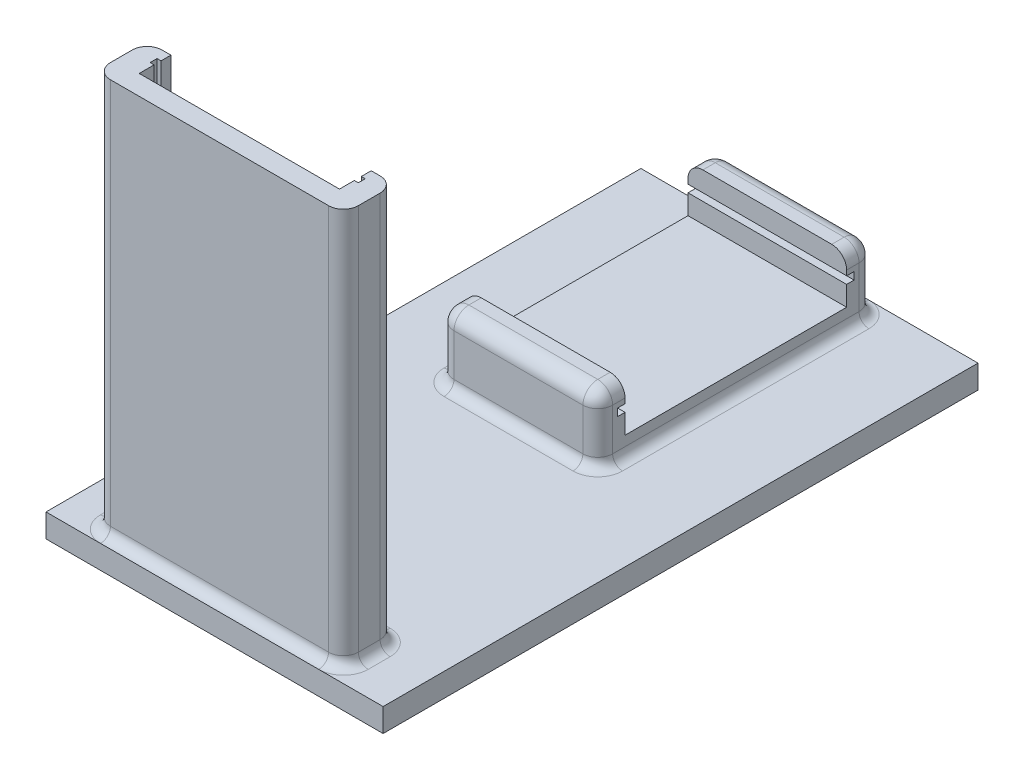
from build123d import *

# Parameters (mm, degrees)
SKETCH2_W               = 88.9
SKETCH2_H               = 152.4
BOSS_EXTRUDE1_DEPTH     = 5.9944
CUT_EXTRUDE2_DEPTH      = 177.535840076
CUT_EXTRUDE2_DEPTH_BACK = 177.535840076
SKETCH4_R               = 2.7305
BOSS_EXTRUDE2_DEPTH     = 101.6
FILLET1_R               = 3.81
FILLET2_R               = 2.54
BOSS_EXTRUDE3_DEPTH     = 20.32
FILLET3_R               = 3.81
FILLET6_R               = 3.81
FILLET7_R               = 2.54
CUT_EXTRUDE3_DEPTH      = 204.596488182
CUT_EXTRUDE3_DEPTH_BACK = 204.596488182
SKETCH7_W               = 2.54
SKETCH7_H               = 152.4


with BuildPart() as part:
    # Sketch2 → Boss-Extrude1 (new body)
    with BuildSketch(Plane(origin=(0, 0, 0), x_dir=(1, 0, 0), z_dir=(0, 1, 0))):
        with Locations((44.45, 76.2)):
            Rectangle(SKETCH2_W, SKETCH2_H)
    extrude(amount=BOSS_EXTRUDE1_DEPTH)

    # Sketch4 → Cut-Extrude2 (cut, two sides: drawn at the far end of the back side and taken through both)
    with BuildSketch(Plane(origin=(0, 5.9944, 0), x_dir=(1, 0, 0), z_dir=(0, 1, 0)).offset(-CUT_EXTRUDE2_DEPTH_BACK)):
        with Locations(Location((45.72, 109.871331367, 0), (0, 0, 270))):
            Circle(SKETCH4_R)
        with Locations(Location((45.72, 33.671331367, 0), (0, 0, 270))):
            Circle(SKETCH4_R)
    extrude(amount=CUT_EXTRUDE2_DEPTH + CUT_EXTRUDE2_DEPTH_BACK, mode=Mode.SUBTRACT)

    # Sketch5 → Boss-Extrude2 (add)
    with BuildSketch(Plane(origin=(0, 5.9944, 0), x_dir=(1, 0, 0), z_dir=(0, 1, 0))):
        Polygon((18.796, 15.748), (12.7, 15.748), (12.7, 2.54), (76.2, 2.54), (76.2, 15.748), (70.104, 15.748), (70.104, 13.208), (71.12, 13.208), (71.12, 11.43), (70.104, 11.43), (70.104, 7.62), (18.796, 7.62), (18.796, 11.43), (17.78, 11.43), (17.78, 13.208), (18.796, 13.208), align=None)
    extrude(amount=BOSS_EXTRUDE2_DEPTH)

    # Fillet1
    fillet1_edges = [part.edges().sort_by_distance(p)[0] for p in [
        (12.7, 56.7944, -15.748),
        (12.7, 56.7944, -2.54),
        (76.2, 56.7944, -2.54),
        (76.2, 56.7944, -15.748),
    ]]
    fillet(fillet1_edges, radius=FILLET1_R)

    # Fillet2
    fillet2_edges = [part.edges().sort_by_distance(p)[0] for p in [
        (71.247, 5.9944, -15.748),
        (44.45, 5.9944, -2.54),
        (12.7, 5.9944, -9.144),
        (17.653, 5.9944, -15.748),
        (76.2, 5.9944, -9.144),
        (13.815923164, 5.9944, -3.655923164),
        (13.815923164, 5.9944, -14.632076836),
        (75.084076836, 5.9944, -3.655923164),
        (75.084076836, 5.9944, -14.632076836),
    ]]
    fillet(fillet2_edges, radius=FILLET2_R - 0.0001)  # a hair under: the kernel refuses the full size

    # Sketch6 → Boss-Extrude3 (add, symmetric)
    with BuildSketch(Plane.ZY.offset(-44.45)):
        Polygon((-149.86, 5.9944), (-79.121, 5.9944), (-79.121, 23.1394), (-86.106, 23.1394), (-86.106, 18.0594), (-84.201, 18.0594), (-84.201, 16.1544), (-86.106, 16.1544), (-86.106, 11.0744), (-142.875, 11.0744), (-142.875, 16.1544), (-144.78, 16.1544), (-144.78, 18.0594), (-142.875, 18.0594), (-142.875, 23.1394), (-149.86, 23.1394), align=None)
    extrude(amount=BOSS_EXTRUDE3_DEPTH, both=True)

    # Fillet3
    fillet3_edges = [part.edges().sort_by_distance(p)[0] for p in [
        (44.45, 23.1394, -149.86),
        (44.45, 23.1394, -79.121),
    ]]
    fillet(fillet3_edges, radius=FILLET3_R)

    # Fillet6
    fillet6_edges = [part.edges().sort_by_distance(p)[0] for p in [
        (24.13, 12.6619, -149.86),
        (64.77, 12.6619, -79.121),
        (24.13, 23.1394, -84.5185),
        (24.13, 12.6619, -79.121),
        (64.77, 23.1394, -84.5185),
        (64.77, 12.6619, -149.86),
        (64.77, 23.1394, -144.4625),
        (64.77, 22.023476836, -148.744076836),
        (64.77, 22.023476836, -80.236923164),
        (24.13, 23.1394, -144.4625),
        (24.13, 22.023476836, -148.744076836),
        (24.13, 22.023476836, -80.236923164),
    ]]
    fillet(fillet6_edges, radius=FILLET6_R)

    # Fillet7
    fillet7_edges = [part.edges().sort_by_distance(p)[0] for p in [
        (24.13, 5.9944, -114.4905),
        (64.77, 5.9944, -114.4905),
        (44.45, 5.9944, -79.121),
        (44.45, 5.9944, -149.86),
        (25.245923164, 5.9944, -80.236923164),
        (63.654076836, 5.9944, -80.236923164),
        (63.654076836, 5.9944, -148.744076836),
        (25.245923164, 5.9944, -148.744076836),
    ]]
    fillet(fillet7_edges, radius=FILLET7_R - 0.0001)  # a hair under: the kernel refuses the full size

    # Sketch7 → Cut-Extrude3 (cut, two sides: drawn at the far end of the back side and taken through both)
    with BuildSketch(Plane(origin=(0, 5.9944, 0), x_dir=(1, 0, 0), z_dir=(0, 1, 0)).offset(-CUT_EXTRUDE3_DEPTH_BACK)):
        with Locations((1.27, 76.2)):
            Rectangle(SKETCH7_W, SKETCH7_H)
    extrude(amount=CUT_EXTRUDE3_DEPTH + CUT_EXTRUDE3_DEPTH_BACK, mode=Mode.SUBTRACT)


solid = part.part
